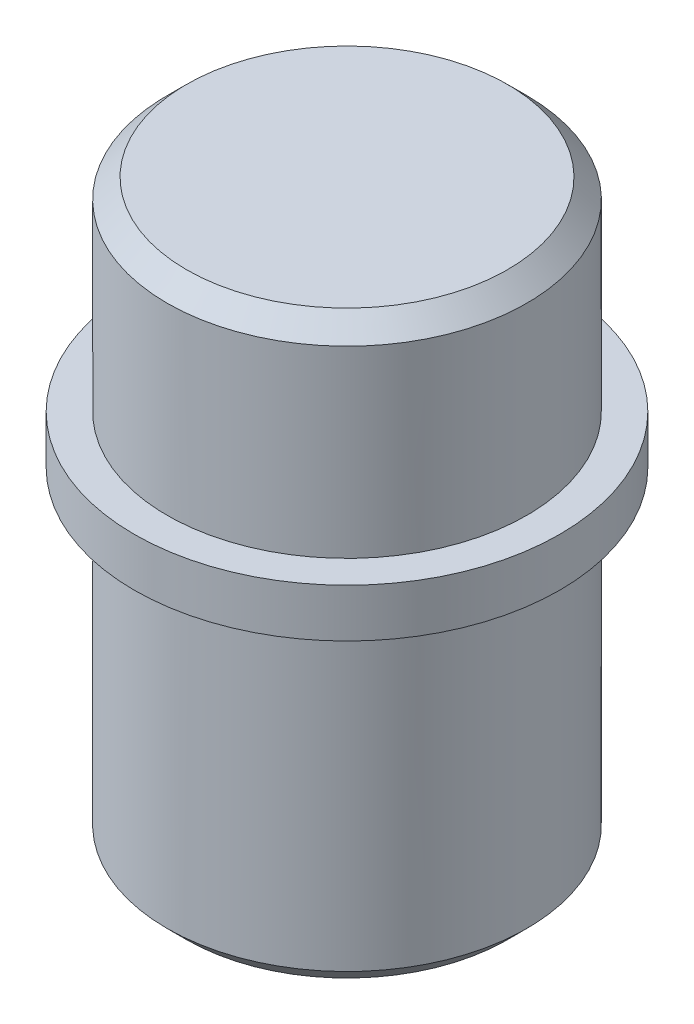
from build123d import *

# Parameters (mm, degrees)
SKETCH1_R           = 9.3
BOSS_EXTRUDE1_DEPTH = 15
CHAMFER1_SIZE       = 1
BOSS_EXTRUDE2_START = -17
SKETCH2_R           = 11
BOSS_EXTRUDE2_DEPTH = 2.5


with BuildPart() as part:
    # Sketch1 → Boss-Extrude1 (new, symmetric)
    with BuildSketch(Plane(origin=(0, 0, 0), x_dir=(1, 0, 0), z_dir=(0, 1, 0))):
        Circle(SKETCH1_R)
    extrude(amount=BOSS_EXTRUDE1_DEPTH, both=True)

    # Chamfer1
    chamfer1_edges = [part.edges().sort_by_distance(p)[0] for p in [
        (-9.3, -15, 0),
        (-9.3, 15, 0),
    ]]
    chamfer(chamfer1_edges, length=CHAMFER1_SIZE)

    # Sketch2 → Boss-Extrude2 (add)
    with BuildSketch(Plane.XZ.offset(15).offset(BOSS_EXTRUDE2_START)):
        Circle(SKETCH2_R)
    extrude(amount=-BOSS_EXTRUDE2_DEPTH)


solid = part.part
